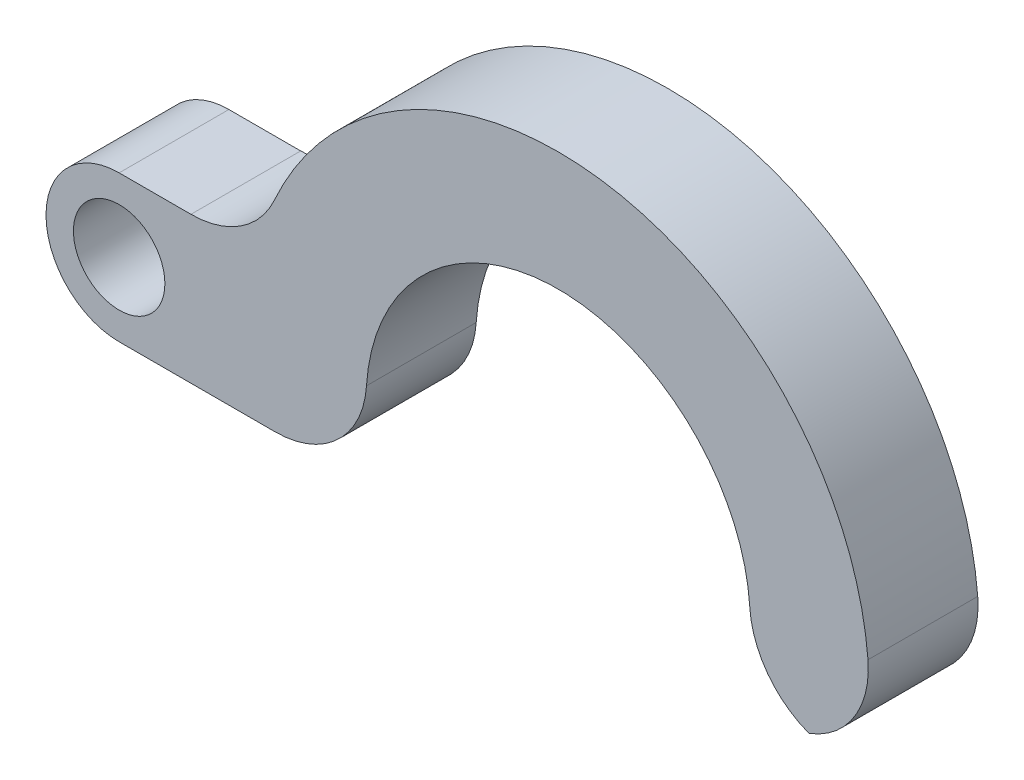
from build123d import *

# Parameters (mm, degrees)
SKETCH_1_R      = 1.25
EXTRUDE_1_DEPTH = 3
FILLET_2_R      = 2.5


with BuildPart() as part:
    # Эскиз1 → Бобышка-Вытянуть1 (new body)
    with BuildSketch(Plane.XY):
        with BuildLine():
            Line((-12, -2), (-4.85412196, -2))
            ThreePointArc((-4.85412196, -2), (0, 5.25), (4.85412196, -2))
            Line((4.85412196, -2), (8.261355821, -2))
            ThreePointArc((8.261355821, -2), (2, 8.261355821), (-8.261355821, 2))
            Line((-8.261355821, 2), (-12, 2))
            ThreePointArc((-12, 2), (-14, 0), (-12, -2))
        make_face()
        with Locations((-12, 0)):
            Circle(SKETCH_1_R, mode=Mode.SUBTRACT)
    extrude(amount=EXTRUDE_1_DEPTH)

    # Скругление2
    # the kernel refuses this fillet: 2.5 mm, written as the material it adds along each edge
    with BuildSketch(Plane(origin=(-8.261355821, 2, 0), x_dir=(0.3235599082125896, 0.9462076863973683, 0), z_dir=(0, 0, 1))) as fillet_2_piece_1:
        with BuildLine():
            CenterArc((1.790852834, 2.489434763), FILLET_2_R, 198.878350274, 65.852260083)
            Line((-0.574666382, 1.680534992), (0, 0))
            ThreePointArc((0, 0), (0.780628158, 0.035921806), (1.561256317, 0))
        make_face()
    extrude(amount=3)
    # the kernel refuses this fillet: 2.5 mm, written as the material it takes off along each edge
    with BuildSketch(Plane(origin=(8.261355821, -2, -6.790979044), x_dir=(-1, 0, 0), z_dir=(0, 0, 1))) as fillet_2_2_piece_1:
        with BuildLine():
            CenterArc((2.282225449, -2.5), FILLET_2_R, 90, 94.780191847)
            ThreePointArc((-0.209078872, -2.708333333), (-0.21342859, -1.345760603), (0, 0))
            Line((0, 0), (2.282225449, 0))
        make_face()
    extrude(amount=16.581958087, mode=Mode.SUBTRACT)
    with BuildSketch(Plane(origin=(4.85412196, -2, -7.199330473), x_dir=(0.16240998892159433, 0.9867233632069768, 0), z_dir=(0, 0, 1))) as fillet_2_2_piece_2:
        with BuildLine():
            CenterArc((2.934505681, -2.435474059), FILLET_2_R, 103.045879434, 86.300928937)
            Line((0.467697273, -2.841499031), (0, 0))
            ThreePointArc((0, 0), (1.185088833, -0.135504477), (2.370177665, 0))
        make_face()
    extrude(amount=17.398660947, mode=Mode.SUBTRACT)
    with BuildSketch(Plane(origin=(-4.85412196, -2, -7.199330473), x_dir=(-1, 0, 0), z_dir=(0, 0, 1))) as fillet_2_2_piece_3:
        with BuildLine():
            CenterArc((2.879732189, -2.5), FILLET_2_R, 90, 86.300928937)
            ThreePointArc((0.384940528, -2.338709677), (0.326175697, -1.147347558), (0, 0))
            Line((0, 0), (2.879732189, 0))
        make_face()
    extrude(amount=17.398660947, mode=Mode.SUBTRACT)


solid = part.part
